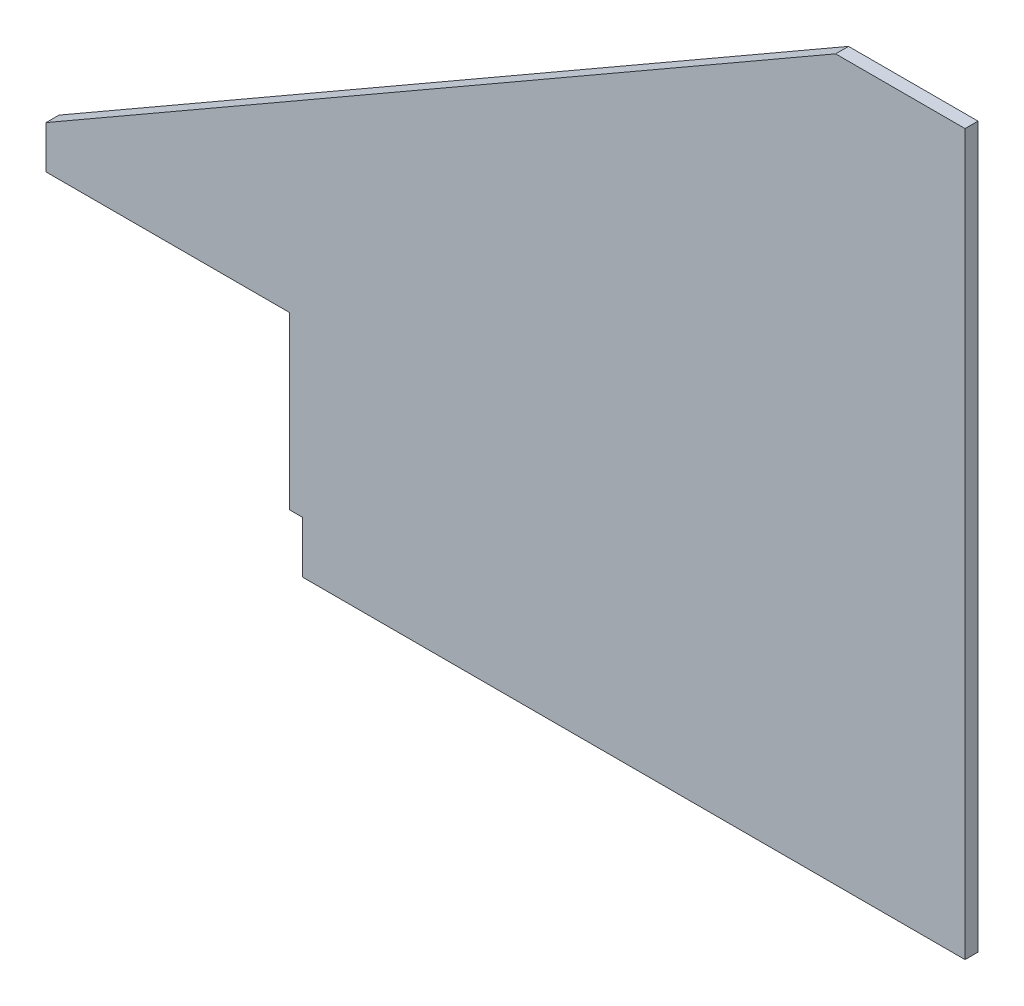
from build123d import *

# Parameters (mm, degrees)
EXTRUDE_1_DEPTH = 5


with BuildPart() as part:
    # 스케치1 → 보스-돌출1 (new body)
    with BuildSketch(Plane.XY):
        Polygon((-128, -139), (128, -139), (128, 139), (78, 139), (-227, -36.492307692), (-227, -53), (-133, -53), (-133, -119), (-128, -119), align=None)
    extrude(amount=EXTRUDE_1_DEPTH)


solid = part.part
